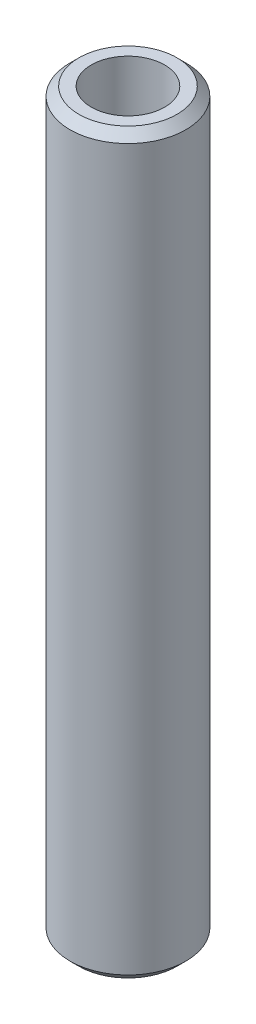
from build123d import *

# Parameters (mm, degrees)
SKETCH1_R           = 35
BOSS_EXTRUDE1_DEPTH = 445.727306534
SKETCH2_R           = 22.149169336
CUT_EXTRUDE1_DEPTH  = 449.467202581
CHAMFER1_SIZE       = 5.372488584


with BuildPart() as part:
    # Sketch1 → Boss-Extrude1 (new body)
    with BuildSketch(Plane(origin=(0, 0, 0), x_dir=(1, 0, 0), z_dir=(0, 1, 0))):
        Circle(SKETCH1_R)
    extrude(amount=BOSS_EXTRUDE1_DEPTH)

    # Sketch2 → Cut-Extrude1 (cut, through all)
    with BuildSketch(Plane(origin=(0, 0, 0), x_dir=(1, 0, 0), z_dir=(0, 1, 0))):
        Circle(SKETCH2_R)
    extrude(amount=CUT_EXTRUDE1_DEPTH, mode=Mode.SUBTRACT)

    # Chamfer1
    chamfer1_edges = [part.edges().sort_by_distance(p)[0] for p in [
        (-35, 445.727306534, 0),
        (-35, 0, 0),
    ]]
    chamfer(chamfer1_edges, length=CHAMFER1_SIZE)


solid = part.part
